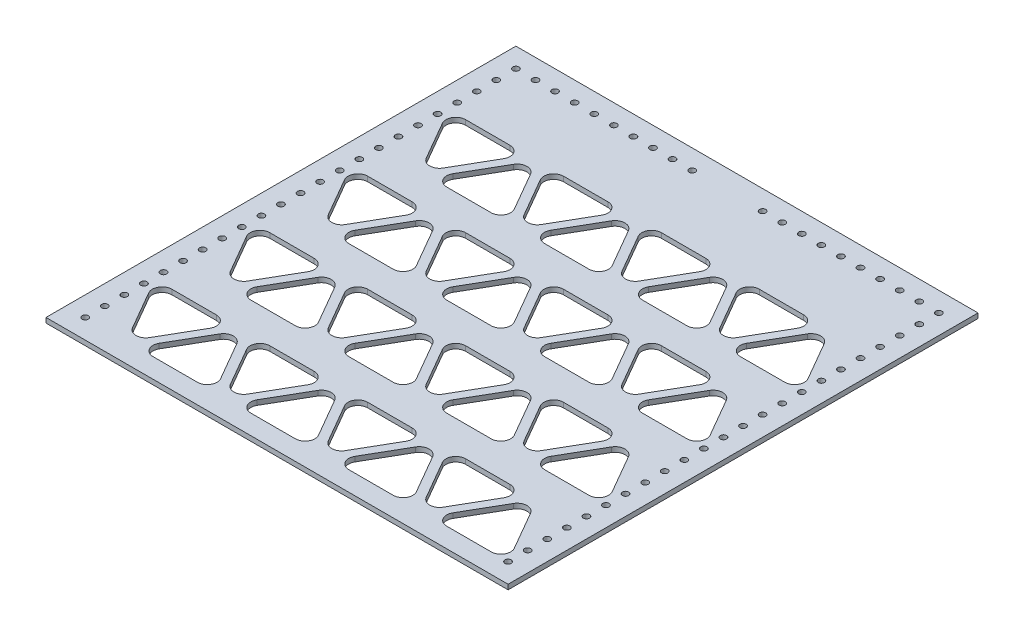
from build123d import *

# Parameters (mm, degrees)
SKETCH1_W                   = 299.72
SKETCH1_H                   = 304.8
BOSS_EXTRUDE1_DEPTH         = 3.175
CUT_EXTRUDE1_DEPTH          = 5.08
FILLET1_R                   = 6.35
FILL_PATTERN1_DEPTH         = 3.175
F_21_0_159_DIAMETER_HOLE1_D = 4.0386
LPATTERN1_COUNT             = 23
LPATTERN1_PITCH             = 12.7
F_21_0_159_DIAMETER_HOLE2_D = 4.0386
LPATTERN2_COUNT             = 9
LPATTERN2_PITCH             = 12.7
F_21_0_159_DIAMETER_HOLE3_D = 4.0386
LPATTERN3_COUNT             = 9
LPATTERN3_PITCH             = 12.7


# Read off the part's stored shape, not the designer's step: Fill Pattern1
with BuildPart() as part:
    # Sketch1 → Boss-Extrude1 (new body)
    with BuildSketch(Plane(origin=(0, 0, 0), x_dir=(1, 0, 0), z_dir=(0, 1, 0))):
        Rectangle(SKETCH1_W, SKETCH1_H)
    extrude(amount=BOSS_EXTRUDE1_DEPTH)

    # Sketch2 → Cut-Extrude1 (cut)
    with BuildSketch(Plane(origin=(0, 3.175, 0), x_dir=(1, 0, 0), z_dir=(0, 1, 0))):
        Polygon((86.36, -139.7), (111.76, -95.705909488), (137.16, -139.7), align=None)
        Polygon((80.01, -139.7), (54.61, -95.705909488), (105.41, -95.705909488), align=None)
    extrude(amount=-CUT_EXTRUDE1_DEPTH, mode=Mode.SUBTRACT)

    # Fillet1
    fillet1_edges = [part.edges().sort_by_distance(p)[0] for p in [
        (105.41, 1.5875, 95.705909488),
        (80.01, 1.5875, 139.7),
        (54.61, 1.5875, 95.705909488),
        (137.16, 1.5875, 139.7),
        (86.36, 1.5875, 139.7),
        (111.76, 1.5875, 95.705909488),
    ]]
    fillet(fillet1_edges, radius=FILLET1_R)

    # Fill Pattern1 outline → Fill Pattern1 (cut)
    with BuildSketch(Plane(origin=(0, 0, 0), x_dir=(1, 0, 0), z_dir=(0, 1, 0))):
        with BuildLine():
            ThreePointArc((-98.640738686, -130.175), (-98.640738686, -136.525), (-93.141477372, -139.7))
            Line((-93.141477372, -139.7), (-64.338522628, -139.7))
            ThreePointArc((-64.338522628, -139.7), (-58.839261314, -136.525), (-58.839261314, -130.175))
            Line((-58.839261314, -130.175), (-73.240738686, -105.230909488))
            ThreePointArc((-73.240738686, -105.230909488), (-78.74, -102.055909488), (-84.239261314, -105.230909488))
            Line((-84.239261314, -105.230909488), (-98.640738686, -130.175))
        make_face()
        with BuildLine():
            ThreePointArc((28.359261314, -130.175), (28.359261314, -136.525), (33.858522628, -139.7))
            Line((33.858522628, -139.7), (62.661477372, -139.7))
            ThreePointArc((62.661477372, -139.7), (68.160738686, -136.525), (68.160738686, -130.175))
            Line((68.160738686, -130.175), (53.759261314, -105.230909488))
            ThreePointArc((53.759261314, -105.230909488), (48.26, -102.055909488), (42.760738686, -105.230909488))
            Line((42.760738686, -105.230909488), (28.359261314, -130.175))
        make_face()
        with BuildLine():
            ThreePointArc((-35.140738686, -130.175), (-35.140738686, -136.525), (-29.641477372, -139.7))
            Line((-29.641477372, -139.7), (-0.838522628, -139.7))
            ThreePointArc((-0.838522628, -139.7), (4.660738686, -136.525), (4.660738686, -130.175))
            Line((4.660738686, -130.175), (-9.740738686, -105.230909488))
            ThreePointArc((-9.740738686, -105.230909488), (-15.24, -102.055909488), (-20.739261314, -105.230909488))
            Line((-20.739261314, -105.230909488), (-35.140738686, -130.175))
        make_face()
        with BuildLine():
            ThreePointArc((-90.589261314, -105.230909488), (-90.589261314, -98.880909488), (-96.088522628, -95.705909488))
            Line((-96.088522628, -95.705909488), (-124.891477372, -95.705909488))
            ThreePointArc((-124.891477372, -95.705909488), (-130.390738686, -98.880909488), (-130.390738686, -105.230909488))
            Line((-130.390738686, -105.230909488), (-115.989261314, -130.175))
            ThreePointArc((-115.989261314, -130.175), (-110.49, -133.35), (-104.990738686, -130.175))
            Line((-104.990738686, -130.175), (-90.589261314, -105.230909488))
        make_face()
        with BuildLine():
            ThreePointArc((36.410738686, -105.230909488), (36.410738686, -98.880909488), (30.911477372, -95.705909488))
            Line((30.911477372, -95.705909488), (2.108522628, -95.705909488))
            ThreePointArc((2.108522628, -95.705909488), (-3.390738686, -98.880909488), (-3.390738686, -105.230909488))
            Line((-3.390738686, -105.230909488), (11.010738686, -130.175))
            ThreePointArc((11.010738686, -130.175), (16.51, -133.35), (22.009261314, -130.175))
            Line((22.009261314, -130.175), (36.410738686, -105.230909488))
        make_face()
        with BuildLine():
            ThreePointArc((-27.089261314, -105.230909488), (-27.089261314, -98.880909488), (-32.588522628, -95.705909488))
            Line((-32.588522628, -95.705909488), (-61.391477372, -95.705909488))
            ThreePointArc((-61.391477372, -95.705909488), (-66.890738686, -98.880909488), (-66.890738686, -105.230909488))
            Line((-66.890738686, -105.230909488), (-52.489261314, -130.175))
            ThreePointArc((-52.489261314, -130.175), (-46.99, -133.35), (-41.490738686, -130.175))
            Line((-41.490738686, -130.175), (-27.089261314, -105.230909488))
        make_face()
        with BuildLine():
            ThreePointArc((28.359261314, -66.675), (28.359261314, -73.025), (33.858522628, -76.2))
            Line((33.858522628, -76.2), (62.661477372, -76.2))
            ThreePointArc((62.661477372, -76.2), (68.160738686, -73.025), (68.160738686, -66.675))
            Line((68.160738686, -66.675), (53.759261314, -41.730909488))
            ThreePointArc((53.759261314, -41.730909488), (48.26, -38.555909488), (42.760738686, -41.730909488))
            Line((42.760738686, -41.730909488), (28.359261314, -66.675))
        make_face()
        with BuildLine():
            ThreePointArc((-98.640738686, -66.675), (-98.640738686, -73.025), (-93.141477372, -76.2))
            Line((-93.141477372, -76.2), (-64.338522628, -76.2))
            ThreePointArc((-64.338522628, -76.2), (-58.839261314, -73.025), (-58.839261314, -66.675))
            Line((-58.839261314, -66.675), (-73.240738686, -41.730909488))
            ThreePointArc((-73.240738686, -41.730909488), (-78.74, -38.555909488), (-84.239261314, -41.730909488))
            Line((-84.239261314, -41.730909488), (-98.640738686, -66.675))
        make_face()
        with BuildLine():
            ThreePointArc((91.859261314, -66.675), (91.859261314, -73.025), (97.358522628, -76.2))
            Line((97.358522628, -76.2), (126.161477372, -76.2))
            ThreePointArc((126.161477372, -76.2), (131.660738686, -73.025), (131.660738686, -66.675))
            Line((131.660738686, -66.675), (117.259261314, -41.730909488))
            ThreePointArc((117.259261314, -41.730909488), (111.76, -38.555909488), (106.260738686, -41.730909488))
            Line((106.260738686, -41.730909488), (91.859261314, -66.675))
        make_face()
        with BuildLine():
            ThreePointArc((-35.140738686, -66.675), (-35.140738686, -73.025), (-29.641477372, -76.2))
            Line((-29.641477372, -76.2), (-0.838522628, -76.2))
            ThreePointArc((-0.838522628, -76.2), (4.660738686, -73.025), (4.660738686, -66.675))
            Line((4.660738686, -66.675), (-9.740738686, -41.730909488))
            ThreePointArc((-9.740738686, -41.730909488), (-15.24, -38.555909488), (-20.739261314, -41.730909488))
            Line((-20.739261314, -41.730909488), (-35.140738686, -66.675))
        make_face()
        with BuildLine():
            ThreePointArc((11.010738686, 60.325), (16.51, 57.15), (22.009261314, 60.325))
            Line((22.009261314, 60.325), (36.410738686, 85.269090512))
            ThreePointArc((36.410738686, 85.269090512), (36.410738686, 91.619090512), (30.911477372, 94.794090512))
            Line((30.911477372, 94.794090512), (2.108522628, 94.794090512))
            ThreePointArc((2.108522628, 94.794090512), (-3.390738686, 91.619090512), (-3.390738686, 85.269090512))
            Line((-3.390738686, 85.269090512), (11.010738686, 60.325))
        make_face()
        with BuildLine():
            ThreePointArc((99.910738686, 85.269090512), (99.910738686, 91.619090512), (94.411477372, 94.794090512))
            Line((94.411477372, 94.794090512), (65.608522628, 94.794090512))
            ThreePointArc((65.608522628, 94.794090512), (60.109261314, 91.619090512), (60.109261314, 85.269090512))
            Line((60.109261314, 85.269090512), (74.510738686, 60.325))
            ThreePointArc((74.510738686, 60.325), (80.01, 57.15), (85.509261314, 60.325))
            Line((85.509261314, 60.325), (99.910738686, 85.269090512))
        make_face()
        with BuildLine():
            ThreePointArc((-90.589261314, 85.269090512), (-90.589261314, 91.619090512), (-96.088522628, 94.794090512))
            Line((-96.088522628, 94.794090512), (-124.891477372, 94.794090512))
            ThreePointArc((-124.891477372, 94.794090512), (-130.390738686, 91.619090512), (-130.390738686, 85.269090512))
            Line((-130.390738686, 85.269090512), (-115.989261314, 60.325))
            ThreePointArc((-115.989261314, 60.325), (-110.49, 57.15), (-104.990738686, 60.325))
            Line((-104.990738686, 60.325), (-90.589261314, 85.269090512))
        make_face()
        with BuildLine():
            ThreePointArc((-27.089261314, 85.269090512), (-27.089261314, 91.619090512), (-32.588522628, 94.794090512))
            Line((-32.588522628, 94.794090512), (-61.391477372, 94.794090512))
            ThreePointArc((-61.391477372, 94.794090512), (-66.890738686, 91.619090512), (-66.890738686, 85.269090512))
            Line((-66.890738686, 85.269090512), (-52.489261314, 60.325))
            ThreePointArc((-52.489261314, 60.325), (-46.99, 57.15), (-41.490738686, 60.325))
            Line((-41.490738686, 60.325), (-27.089261314, 85.269090512))
        make_face()
        with BuildLine():
            ThreePointArc((91.859261314, 60.325), (91.859261314, 53.975), (97.358522628, 50.8))
            Line((97.358522628, 50.8), (126.161477372, 50.8))
            ThreePointArc((126.161477372, 50.8), (131.660738686, 53.975), (131.660738686, 60.325))
            Line((131.660738686, 60.325), (117.259261314, 85.269090512))
            ThreePointArc((117.259261314, 85.269090512), (111.76, 88.444090512), (106.260738686, 85.269090512))
            Line((106.260738686, 85.269090512), (91.859261314, 60.325))
        make_face()
        with BuildLine():
            ThreePointArc((-35.140738686, 60.325), (-35.140738686, 53.975), (-29.641477372, 50.8))
            Line((-29.641477372, 50.8), (-0.838522628, 50.8))
            ThreePointArc((-0.838522628, 50.8), (4.660738686, 53.975), (4.660738686, 60.325))
            Line((4.660738686, 60.325), (-9.740738686, 85.269090512))
            ThreePointArc((-9.740738686, 85.269090512), (-15.24, 88.444090512), (-20.739261314, 85.269090512))
            Line((-20.739261314, 85.269090512), (-35.140738686, 60.325))
        make_face()
        with BuildLine():
            ThreePointArc((28.359261314, 60.325), (28.359261314, 53.975), (33.858522628, 50.8))
            Line((33.858522628, 50.8), (62.661477372, 50.8))
            ThreePointArc((62.661477372, 50.8), (68.160738686, 53.975), (68.160738686, 60.325))
            Line((68.160738686, 60.325), (53.759261314, 85.269090512))
            ThreePointArc((53.759261314, 85.269090512), (48.26, 88.444090512), (42.760738686, 85.269090512))
            Line((42.760738686, 85.269090512), (28.359261314, 60.325))
        make_face()
        with BuildLine():
            ThreePointArc((-98.640738686, 60.325), (-98.640738686, 53.975), (-93.141477372, 50.8))
            Line((-93.141477372, 50.8), (-64.338522628, 50.8))
            ThreePointArc((-64.338522628, 50.8), (-58.839261314, 53.975), (-58.839261314, 60.325))
            Line((-58.839261314, 60.325), (-73.240738686, 85.269090512))
            ThreePointArc((-73.240738686, 85.269090512), (-78.74, 88.444090512), (-84.239261314, 85.269090512))
            Line((-84.239261314, 85.269090512), (-98.640738686, 60.325))
        make_face()
        with BuildLine():
            ThreePointArc((-115.989261314, -3.175), (-110.49, -6.35), (-104.990738686, -3.175))
            Line((-104.990738686, -3.175), (-90.589261314, 21.769090512))
            ThreePointArc((-90.589261314, 21.769090512), (-90.589261314, 28.119090512), (-96.088522628, 31.294090512))
            Line((-96.088522628, 31.294090512), (-124.891477372, 31.294090512))
            ThreePointArc((-124.891477372, 31.294090512), (-130.390738686, 28.119090512), (-130.390738686, 21.769090512))
            Line((-130.390738686, 21.769090512), (-115.989261314, -3.175))
        make_face()
        with BuildLine():
            ThreePointArc((-27.089261314, 21.769090512), (-27.089261314, 28.119090512), (-32.588522628, 31.294090512))
            Line((-32.588522628, 31.294090512), (-61.391477372, 31.294090512))
            ThreePointArc((-61.391477372, 31.294090512), (-66.890738686, 28.119090512), (-66.890738686, 21.769090512))
            Line((-66.890738686, 21.769090512), (-52.489261314, -3.175))
            ThreePointArc((-52.489261314, -3.175), (-46.99, -6.35), (-41.490738686, -3.175))
            Line((-41.490738686, -3.175), (-27.089261314, 21.769090512))
        make_face()
        with BuildLine():
            ThreePointArc((36.410738686, 21.769090512), (36.410738686, 28.119090512), (30.911477372, 31.294090512))
            Line((30.911477372, 31.294090512), (2.108522628, 31.294090512))
            ThreePointArc((2.108522628, 31.294090512), (-3.390738686, 28.119090512), (-3.390738686, 21.769090512))
            Line((-3.390738686, 21.769090512), (11.010738686, -3.175))
            ThreePointArc((11.010738686, -3.175), (16.51, -6.35), (22.009261314, -3.175))
            Line((22.009261314, -3.175), (36.410738686, 21.769090512))
        make_face()
        with BuildLine():
            ThreePointArc((99.910738686, 21.769090512), (99.910738686, 28.119090512), (94.411477372, 31.294090512))
            Line((94.411477372, 31.294090512), (65.608522628, 31.294090512))
            ThreePointArc((65.608522628, 31.294090512), (60.109261314, 28.119090512), (60.109261314, 21.769090512))
            Line((60.109261314, 21.769090512), (74.510738686, -3.175))
            ThreePointArc((74.510738686, -3.175), (80.01, -6.35), (85.509261314, -3.175))
            Line((85.509261314, -3.175), (99.910738686, 21.769090512))
        make_face()
        with BuildLine():
            ThreePointArc((-115.989261314, -66.675), (-110.49, -69.85), (-104.990738686, -66.675))
            Line((-104.990738686, -66.675), (-90.589261314, -41.730909488))
            ThreePointArc((-90.589261314, -41.730909488), (-90.589261314, -35.380909488), (-96.088522628, -32.205909488))
            Line((-96.088522628, -32.205909488), (-124.891477372, -32.205909488))
            ThreePointArc((-124.891477372, -32.205909488), (-130.390738686, -35.380909488), (-130.390738686, -41.730909488))
            Line((-130.390738686, -41.730909488), (-115.989261314, -66.675))
        make_face()
        with BuildLine():
            ThreePointArc((36.410738686, -41.730909488), (36.410738686, -35.380909488), (30.911477372, -32.205909488))
            Line((30.911477372, -32.205909488), (2.108522628, -32.205909488))
            ThreePointArc((2.108522628, -32.205909488), (-3.390738686, -35.380909488), (-3.390738686, -41.730909488))
            Line((-3.390738686, -41.730909488), (11.010738686, -66.675))
            ThreePointArc((11.010738686, -66.675), (16.51, -69.85), (22.009261314, -66.675))
            Line((22.009261314, -66.675), (36.410738686, -41.730909488))
        make_face()
        with BuildLine():
            ThreePointArc((99.910738686, -41.730909488), (99.910738686, -35.380909488), (94.411477372, -32.205909488))
            Line((94.411477372, -32.205909488), (65.608522628, -32.205909488))
            ThreePointArc((65.608522628, -32.205909488), (60.109261314, -35.380909488), (60.109261314, -41.730909488))
            Line((60.109261314, -41.730909488), (74.510738686, -66.675))
            ThreePointArc((74.510738686, -66.675), (80.01, -69.85), (85.509261314, -66.675))
            Line((85.509261314, -66.675), (99.910738686, -41.730909488))
        make_face()
        with BuildLine():
            ThreePointArc((-27.089261314, -41.730909488), (-27.089261314, -35.380909488), (-32.588522628, -32.205909488))
            Line((-32.588522628, -32.205909488), (-61.391477372, -32.205909488))
            ThreePointArc((-61.391477372, -32.205909488), (-66.890738686, -35.380909488), (-66.890738686, -41.730909488))
            Line((-66.890738686, -41.730909488), (-52.489261314, -66.675))
            ThreePointArc((-52.489261314, -66.675), (-46.99, -69.85), (-41.490738686, -66.675))
            Line((-41.490738686, -66.675), (-27.089261314, -41.730909488))
        make_face()
        with BuildLine():
            ThreePointArc((-98.640738686, -3.175), (-98.640738686, -9.525), (-93.141477372, -12.7))
            Line((-93.141477372, -12.7), (-64.338522628, -12.7))
            ThreePointArc((-64.338522628, -12.7), (-58.839261314, -9.525), (-58.839261314, -3.175))
            Line((-58.839261314, -3.175), (-73.240738686, 21.769090512))
            ThreePointArc((-73.240738686, 21.769090512), (-78.74, 24.944090512), (-84.239261314, 21.769090512))
            Line((-84.239261314, 21.769090512), (-98.640738686, -3.175))
        make_face()
        with BuildLine():
            ThreePointArc((-35.140738686, -3.175), (-35.140738686, -9.525), (-29.641477372, -12.7))
            Line((-29.641477372, -12.7), (-0.838522628, -12.7))
            ThreePointArc((-0.838522628, -12.7), (4.660738686, -9.525), (4.660738686, -3.175))
            Line((4.660738686, -3.175), (-9.740738686, 21.769090512))
            ThreePointArc((-9.740738686, 21.769090512), (-15.24, 24.944090512), (-20.739261314, 21.769090512))
            Line((-20.739261314, 21.769090512), (-35.140738686, -3.175))
        make_face()
        with BuildLine():
            ThreePointArc((28.359261314, -3.175), (28.359261314, -9.525), (33.858522628, -12.7))
            Line((33.858522628, -12.7), (62.661477372, -12.7))
            ThreePointArc((62.661477372, -12.7), (68.160738686, -9.525), (68.160738686, -3.175))
            Line((68.160738686, -3.175), (53.759261314, 21.769090512))
            ThreePointArc((53.759261314, 21.769090512), (48.26, 24.944090512), (42.760738686, 21.769090512))
            Line((42.760738686, 21.769090512), (28.359261314, -3.175))
        make_face()
        with BuildLine():
            ThreePointArc((91.859261314, -3.175), (91.859261314, -9.525), (97.358522628, -12.7))
            Line((97.358522628, -12.7), (126.161477372, -12.7))
            ThreePointArc((126.161477372, -12.7), (131.660738686, -9.525), (131.660738686, -3.175))
            Line((131.660738686, -3.175), (117.259261314, 21.769090512))
            ThreePointArc((117.259261314, 21.769090512), (111.76, 24.944090512), (106.260738686, 21.769090512))
            Line((106.260738686, 21.769090512), (91.859261314, -3.175))
        make_face()
    extrude(amount=FILL_PATTERN1_DEPTH, mode=Mode.SUBTRACT)

    # #21 (0.159) Diameter Hole1 (through all)
    with Locations(Plane(origin=(0, 3.175, 0), x_dir=(1, 0, 0), z_dir=(0, 1, 0))):
        with Locations((137.16, -139.7), (-137.16, -139.7)):
            f_21_0_159_diameter_hole1 = Hole(F_21_0_159_DIAMETER_HOLE1_D / 2)

    # LPattern1: #21 (0.159) Diameter Hole1 ×23
    with Locations(*[(0, 0, -i * LPATTERN1_PITCH) for i in range(1, LPATTERN1_COUNT)]):
        add(f_21_0_159_diameter_hole1, mode=Mode.SUBTRACT)

    # #21 (0.159) Diameter Hole2 (through all)
    with Locations(Plane(origin=(0, 3.175, 0), x_dir=(1, 0, 0), z_dir=(0, 1, 0))):
        with Locations((-124.46, 139.7)):
            f_21_0_159_diameter_hole2 = Hole(F_21_0_159_DIAMETER_HOLE2_D / 2)

    # LPattern2: #21 (0.159) Diameter Hole2 ×9
    with Locations(*[(i * LPATTERN2_PITCH, 0, 0) for i in range(1, LPATTERN2_COUNT)]):
        add(f_21_0_159_diameter_hole2, mode=Mode.SUBTRACT)

    # #21 (0.159) Diameter Hole3 (through all)
    with Locations(Plane(origin=(0, 3.175, 0), x_dir=(1, 0, 0), z_dir=(0, 1, 0))):
        with Locations((124.46, 139.7)):
            f_21_0_159_diameter_hole3 = Hole(F_21_0_159_DIAMETER_HOLE3_D / 2)

    # LPattern3: #21 (0.159) Diameter Hole3 ×9
    with Locations(*[(-i * LPATTERN3_PITCH, 0, 0) for i in range(1, LPATTERN3_COUNT)]):
        add(f_21_0_159_diameter_hole3, mode=Mode.SUBTRACT)


solid = part.part
